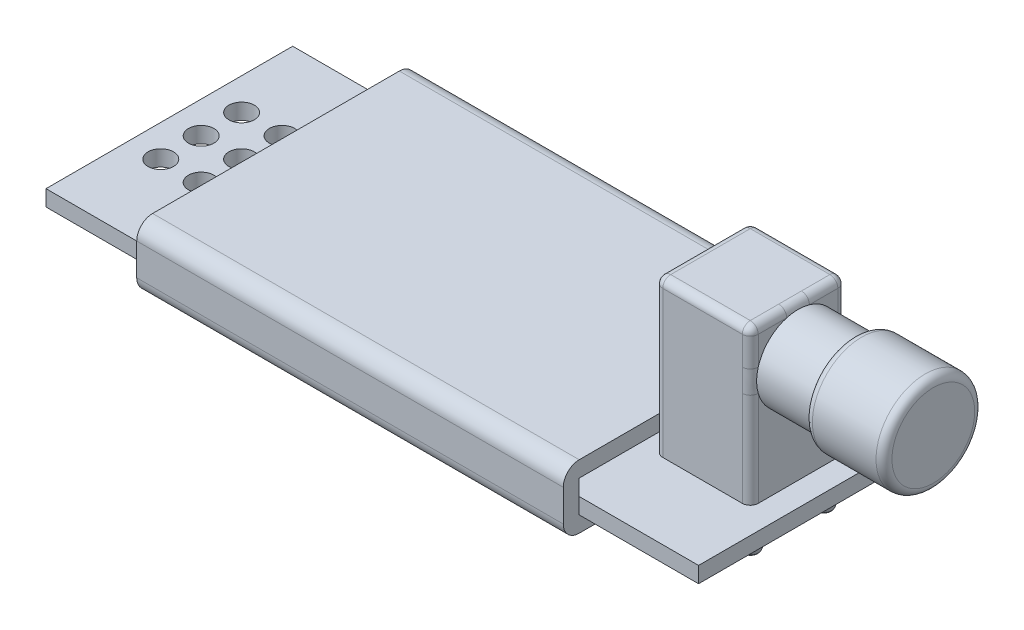
from build123d import *

# Parameters (mm, degrees)
SKETCH_1_W                = 41
SKETCH_1_H                = 15.5
EXTRUDE_1_DEPTH           = 1
SKETCH_2_W                = 6
SKETCH_2_H                = 6
EXTRUDE_2_DEPTH           = 9.7
SKETCH_3_R                = 2.6
EXTRUDE_3_DEPTH           = 3.5
SKETCH_4_R                = 0.8
CUT_EXTRUDE_1_DEPTH       = 26.698297609
SKETCH_5_R                = 3.1
EXTRUDE_4_DEPTH           = 5
FILLET_1_R                = 0.5
FILLET_2_R                = 0.5
SKETCH_6_R                = 1.2
EXTRUDE_5_DEPTH           = 2
EXTRUDE_5_DRAFT           = 20
EXTRUDE_5_PROFILE_2_DEPTH = 2
EXTRUDE_5_PROFILE_2_DRAFT = 20
EXTRUDE_5_PROFILE_3_DEPTH = 2
EXTRUDE_5_PROFILE_3_DRAFT = 20
EXTRUDE_5_PROFILE_4_DEPTH = 2
EXTRUDE_5_PROFILE_4_DRAFT = 20
EXTRUDE_5_PROFILE_5_DEPTH = 2
EXTRUDE_5_PROFILE_5_DRAFT = 20
FILLET_3_R                = 0.2
SKETCH_7_W                = 25.8
SKETCH_7_H                = 12.8
EXTRUDE_6_DEPTH           = 1
FILLET_4_R                = 0.2
SKETCH_8_W                = 15.5
SKETCH_8_H                = 2
EXTRUDE_7_DEPTH           = 26.8


with BuildPart() as part:
    # Эскиз1 → Бобышка-Вытянуть1 (new body)
    with BuildSketch(Plane(origin=(0, 0, 0), x_dir=(1, 0, 0), z_dir=(0, 1, 0))):
        Rectangle(SKETCH_1_W, SKETCH_1_H)
    extrude(amount=EXTRUDE_1_DEPTH)

    # Эскиз2 → Бобышка-Вытянуть2 (add)
    with BuildSketch(Plane(origin=(0, 1, 0), x_dir=(1, 0, 0), z_dir=(0, 1, 0))):
        with Locations((16, 0)):
            Rectangle(SKETCH_2_W, SKETCH_2_H)
    extrude(amount=EXTRUDE_2_DEPTH)

    # Эскиз3 → Бобышка-Вытянуть3 (add)
    with BuildSketch(Plane(origin=(19, 0, 0), x_dir=(0, 0, -1), z_dir=(1, 0, 0))):
        with Locations(Location((0, 7.7, 0), (0, 0, 180))):
            Circle(SKETCH_3_R)
    extrude(amount=EXTRUDE_3_DEPTH)

    # Эскиз4 → Вырез-Вытянуть1 (cut, through all)
    with BuildSketch(Plane(origin=(0, 1, 0), x_dir=(1, 0, 0), z_dir=(0, 1, 0))):
        with Locations(Location((-18.5, -2.54, 0), (0, 0, 270))):
            Circle(SKETCH_4_R)
        with Locations(Location((-18.5, 0, 0), (0, 0, 270))):
            Circle(SKETCH_4_R)
        with Locations(Location((-18.5, 2.54, 0), (0, 0, 270))):
            Circle(SKETCH_4_R)
        with Locations(Location((-15.96, 2.54, 0), (0, 0, 270))):
            Circle(SKETCH_4_R)
        with Locations(Location((-15.96, 0, 0), (0, 0, 270))):
            Circle(SKETCH_4_R)
        with Locations(Location((-15.96, -2.54, 0), (0, 0, 270))):
            Circle(SKETCH_4_R)
    extrude(amount=-CUT_EXTRUDE_1_DEPTH, mode=Mode.SUBTRACT)

    # Эскиз5 → Бобышка-Вытянуть4 (add)
    with BuildSketch(Plane(origin=(22.5, 0, 0), x_dir=(0, 0, -1), z_dir=(1, 0, 0))):
        with Locations((0, 7.7)):
            Circle(SKETCH_5_R)
    extrude(amount=EXTRUDE_4_DEPTH)

    # Скругление1
    fillet_1_edges = [part.edges().sort_by_distance(p)[0] for p in [
        (22.5, 7.7, 3.1),
        (27.5, 7.7, 3.1),
    ]]
    fillet(fillet_1_edges, radius=FILLET_1_R - 0.0001)  # a hair under: the kernel refuses the full size

    # Скругление2
    fillet_2_edges = [part.edges().sort_by_distance(p)[0] for p in [
        (13, 5.85, -3),
        (13, 5.85, 3),
        (19, 5.85, 3),
        (19, 5.85, -3),
        (13, 10.7, 0),
        (16, 10.7, 3),
        (19, 10.7, 0),
        (16, 10.7, -3),
    ]]
    fillet(fillet_2_edges, radius=FILLET_2_R)


with BuildPart() as extrude_5_tool:
    # Эскиз6 → Бобышка-Вытянуть5 (with draft: the straight prism first)
    with BuildSketch(Plane.XZ):
        with Locations((13.7, 2.3)):
            Circle(SKETCH_6_R)
    extrude(amount=EXTRUDE_5_DEPTH)
    # Бобышка-Вытянуть5: the draft: its side faces are tilted about the plane it starts from
    extrude_5_sides = [extrude_5_tool.faces().sort_by_distance(p)[0] for p in [
        (12.5, -1, 2.3),
    ]]
    draft(extrude_5_sides, Plane.XZ, EXTRUDE_5_DRAFT)


with BuildPart() as part_1:
    add(part.part)

    # Бобышка-Вытянуть5: add extrude_5_tool
    add(extrude_5_tool.part)


with BuildPart() as extrude_5_profile_2_tool:
    # Эскиз6 → Бобышка-Вытянуть5 profile 2 (with draft: the straight prism first)
    with BuildSketch(Plane.XZ):
        with Locations((18.3, 2.3)):
            Circle(SKETCH_6_R)
    extrude(amount=EXTRUDE_5_PROFILE_2_DEPTH)
    # Бобышка-Вытянуть5 profile 2: the draft: its side faces are tilted about the plane it starts from
    extrude_5_profile_2_sides = [extrude_5_profile_2_tool.faces().sort_by_distance(p)[0] for p in [
        (17.1, -1, 2.3),
    ]]
    draft(extrude_5_profile_2_sides, Plane.XZ, EXTRUDE_5_PROFILE_2_DRAFT)


with BuildPart() as part_2:
    add(part_1.part)

    # Бобышка-Вытянуть5 profile 2: add extrude_5_profile_2_tool
    add(extrude_5_profile_2_tool.part)


with BuildPart() as extrude_5_profile_3_tool:
    # Эскиз6 → Бобышка-Вытянуть5 profile 3 (with draft: the straight prism first)
    with BuildSketch(Plane.XZ):
        with Locations((18.3, -2.3)):
            Circle(SKETCH_6_R)
    extrude(amount=EXTRUDE_5_PROFILE_3_DEPTH)
    # Бобышка-Вытянуть5 profile 3: the draft: its side faces are tilted about the plane it starts from
    extrude_5_profile_3_sides = [extrude_5_profile_3_tool.faces().sort_by_distance(p)[0] for p in [
        (17.1, -1, -2.3),
    ]]
    draft(extrude_5_profile_3_sides, Plane.XZ, EXTRUDE_5_PROFILE_3_DRAFT)


with BuildPart() as part_3:
    add(part_2.part)

    # Бобышка-Вытянуть5 profile 3: add extrude_5_profile_3_tool
    add(extrude_5_profile_3_tool.part)


with BuildPart() as extrude_5_profile_4_tool:
    # Эскиз6 → Бобышка-Вытянуть5 profile 4 (with draft: the straight prism first)
    with BuildSketch(Plane.XZ):
        with Locations((16, 0)):
            Circle(SKETCH_6_R)
    extrude(amount=EXTRUDE_5_PROFILE_4_DEPTH)
    # Бобышка-Вытянуть5 profile 4: the draft: its side faces are tilted about the plane it starts from
    extrude_5_profile_4_sides = [extrude_5_profile_4_tool.faces().sort_by_distance(p)[0] for p in [
        (14.8, -1, 0),
    ]]
    draft(extrude_5_profile_4_sides, Plane.XZ, EXTRUDE_5_PROFILE_4_DRAFT)


with BuildPart() as part_4:
    add(part_3.part)

    # Бобышка-Вытянуть5 profile 4: add extrude_5_profile_4_tool
    add(extrude_5_profile_4_tool.part)


with BuildPart() as extrude_5_profile_5_tool:
    # Эскиз6 → Бобышка-Вытянуть5 profile 5 (with draft: the straight prism first)
    with BuildSketch(Plane.XZ):
        with Locations((13.7, -2.3)):
            Circle(SKETCH_6_R)
    extrude(amount=EXTRUDE_5_PROFILE_5_DEPTH)
    # Бобышка-Вытянуть5 profile 5: the draft: its side faces are tilted about the plane it starts from
    extrude_5_profile_5_sides = [extrude_5_profile_5_tool.faces().sort_by_distance(p)[0] for p in [
        (12.5, -1, -2.3),
    ]]
    draft(extrude_5_profile_5_sides, Plane.XZ, EXTRUDE_5_PROFILE_5_DRAFT)


with BuildPart() as part_5:
    add(part_4.part)

    # Бобышка-Вытянуть5 profile 5: add extrude_5_profile_5_tool
    add(extrude_5_profile_5_tool.part)

    # Скругление3
    fillet_3_edges = [part_5.edges().sort_by_distance(p)[0] for p in [
        (17.827940469, -2, 2.3),
        (13.227940469, -2, 2.3),
        (17.827940469, -2, -2.3),
        (15.527940469, -2, 0),
        (13.227940469, -2, -2.3),
    ]]
    fillet(fillet_3_edges, radius=FILLET_3_R)

    # Эскиз7 → Бобышка-Вытянуть6 (add)
    with BuildSketch(Plane(origin=(0, 1, 0), x_dir=(1, 0, 0), z_dir=(0, 1, 0))):
        with Locations((-0.9, 0.35)):
            Rectangle(SKETCH_7_W, SKETCH_7_H)
    extrude(amount=EXTRUDE_6_DEPTH)

    # Скругление4
    fillet_4_edges = [part_5.edges().sort_by_distance(p)[0] for p in [
        (12, 2, -0.35),
        (-0.9, 2, -6.75),
        (-13.8, 2, -0.35),
        (-0.9, 2, 6.05),
    ]]
    fillet(fillet_4_edges, radius=FILLET_4_R)


with BuildPart() as body_2:
    # Эскиз8 → Бобышка-Вытянуть7 (new body)
    with BuildSketch(Plane.ZY.offset(13.8)):
        with BuildLine():
            Line((-7.75, 3), (7.75, 3))
            ThreePointArc((7.75, 3), (8.457106781, 2.707106781), (8.75, 2))
            Line((8.75, 2), (8.75, 0))
            ThreePointArc((8.75, 0), (8.457106781, -0.707106781), (7.75, -1))
            Line((7.75, -1), (-7.75, -1))
            ThreePointArc((-7.75, -1), (-8.457106781, -0.707106781), (-8.75, 0))
            Line((-8.75, 0), (-8.75, 2))
            ThreePointArc((-8.75, 2), (-8.457106781, 2.707106781), (-7.75, 3))
        make_face()
        with Locations((0, 1)):
            Rectangle(SKETCH_8_W, SKETCH_8_H, mode=Mode.SUBTRACT)
    extrude(amount=-EXTRUDE_7_DEPTH)


solid = Compound([part_5.part, body_2.part])
